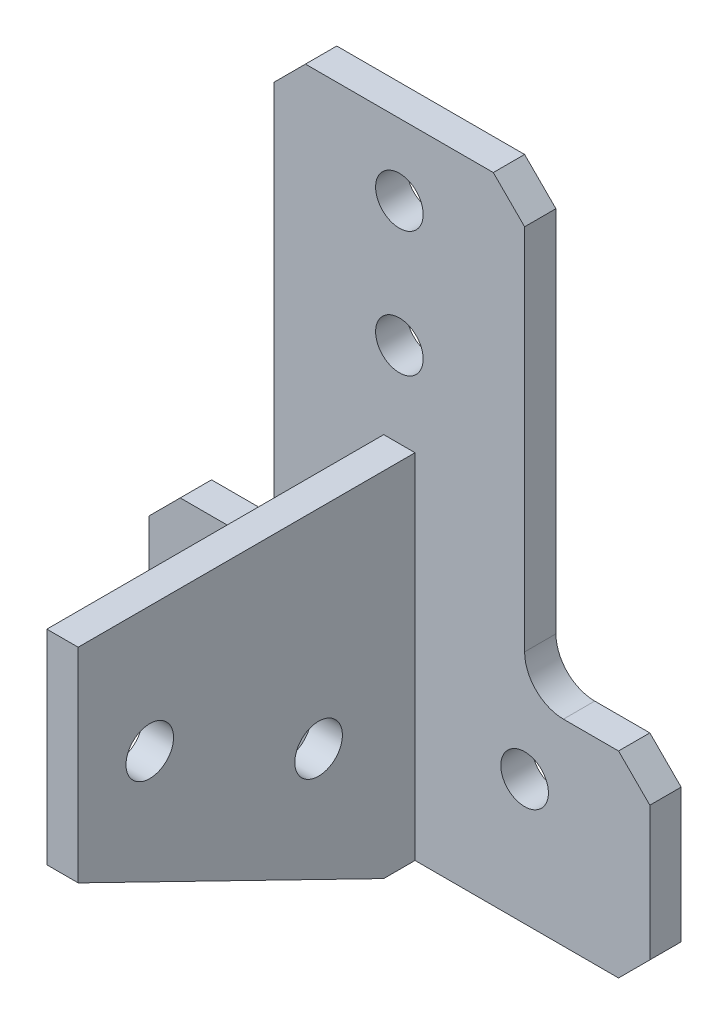
from build123d import *

# Parameters (mm, degrees)
BOSS_EXTRUDE1_DEPTH     = 64.389
CUT_EXTRUDE1_DEPTH      = 87.341811871
CUT_EXTRUDE1_DEPTH_BACK = 87.341811871
SKETCH7_W               = 47.625
SKETCH7_H               = 28.575
SKETCH8_W               = 12.7
SKETCH8_H               = 44.45
CUT_EXTRUDE2_DEPTH      = 85.512774787
CHAMFER1_SIZE           = 44.45
CHAMFER1_SIZE2          = 21.679713562
SKETCH4_R               = 2.413
CUT_EXTRUDE3_DEPTH      = 85.512774787
SKETCH9_R               = 2.413
CUT_EXTRUDE5_DEPTH      = 85.512774787
SKETCH10_R              = 2.413
CUT_EXTRUDE6_DEPTH      = 87.341811871
FILLET1_R               = 3.937
CHAMFER2_SIZE           = 3.175


with BuildPart() as part:
    # Sketch1 → Boss-Extrude1 (new body)
    with BuildSketch(Plane(origin=(0, 0, 0), x_dir=(1, 0, 0), z_dir=(0, 1, 0))):
        Polygon((3.175, 47.625), (26.9875, 47.625), (26.9875, 50.8), (-23.8125, 50.8), (-23.8125, 47.625), (0, 47.625), (0, 0), (3.175, 0), align=None)
    extrude(amount=BOSS_EXTRUDE1_DEPTH)

    # Sketch7 → Cut-Extrude1 (cut, two sides: drawn at the far end of the back side and taken through both)
    with BuildSketch(Plane.ZY.offset(-CUT_EXTRUDE1_DEPTH_BACK)):
        with Locations((-23.8125, 50.1015)):
            Rectangle(SKETCH7_W, SKETCH7_H)
    extrude(amount=CUT_EXTRUDE1_DEPTH + CUT_EXTRUDE1_DEPTH_BACK, mode=Mode.SUBTRACT)

    # Sketch8 → Cut-Extrude2 (cut, through all)
    with BuildSketch(Plane.XY.offset(-47.625)):
        with Locations((20.6375, 42.164)):
            Rectangle(SKETCH8_W, SKETCH8_H)
        with Locations((-17.4625, 42.164)):
            Rectangle(SKETCH8_W, SKETCH8_H)
    extrude(amount=-CUT_EXTRUDE2_DEPTH, mode=Mode.SUBTRACT)

    # Chamfer1
    chamfer1_edges = [part.edges().sort_by_distance(p)[0] for p in [
        (1.5875, 0, 0),
    ]]
    chamfer1_side = [part.faces().sort_by_distance(p)[0] for p in [
        (1.5875, 0, -36.922177419),
    ]]
    chamfer(chamfer1_edges, length=CHAMFER1_SIZE, length2=CHAMFER1_SIZE2, reference=chamfer1_side[0])

    # Sketch4 → Cut-Extrude3 (cut, through all)
    with BuildSketch(Plane.XY.offset(-47.625)):
        with Locations((14.2875, 12.7)):
            Circle(SKETCH4_R)
        with Locations((-11.1125, 12.7)):
            Circle(SKETCH4_R)
    extrude(amount=-CUT_EXTRUDE3_DEPTH, mode=Mode.SUBTRACT)

    # Sketch9 → Cut-Extrude5 (cut, through all)
    with BuildSketch(Plane.XY.offset(-47.625)):
        with Locations((1.5875, 57.15)):
            Circle(SKETCH9_R)
        with Locations((1.5875, 44.45)):
            Circle(SKETCH9_R)
    extrude(amount=-CUT_EXTRUDE5_DEPTH, mode=Mode.SUBTRACT)

    # Sketch10 → Cut-Extrude6 (cut, through all)
    with BuildSketch(Plane(origin=(3.175, 0, 0), x_dir=(0, 0, -1), z_dir=(1, 0, 0))):
        with Locations((37.846, 14.70914)):
            Circle(SKETCH10_R)
        with Locations((20.723973418, 23.060110346)):
            Circle(SKETCH10_R)
        Polygon((13.462, 35.814), (13.462, 15.113857454), (0, 21.679713562), (0, 35.814), align=None)
    extrude(amount=-CUT_EXTRUDE6_DEPTH, mode=Mode.SUBTRACT)

    # Fillet1
    fillet1_edges = [part.edges().sort_by_distance(p)[0] for p in [
        (-11.1125, 19.939, -49.2125),
        (14.2875, 19.939, -49.2125),
    ]]
    fillet(fillet1_edges, radius=FILLET1_R)

    # Chamfer2
    chamfer2_edges = [part.edges().sort_by_distance(p)[0] for p in [
        (-11.1125, 64.389, -49.2125),
        (14.2875, 64.389, -49.2125),
        (26.9875, 19.939, -49.2125),
        (26.9875, 0, -49.2125),
        (-23.8125, 0, -49.2125),
        (-23.8125, 19.939, -49.2125),
    ]]
    chamfer(chamfer2_edges, length=CHAMFER2_SIZE)


solid = part.part
